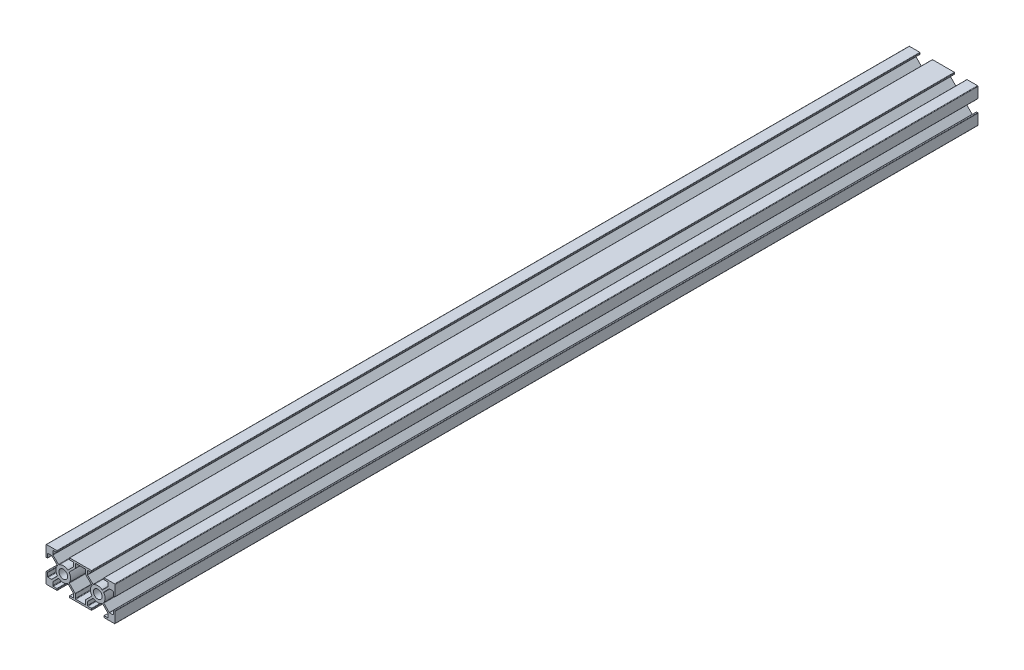
from build123d import *

# Parameters (mm, degrees)
SKETCH1_R           = 2.5
BOSS_EXTRUDE1_DEPTH = 500


with BuildPart() as part:
    # Sketch1 → Boss-Extrude1 (new body)
    with BuildSketch(Plane.XY):
        with BuildLine():
            Line((-16.626227687, 5.919120906), (-13.506610538, 2.799503757))
            ThreePointArc((-13.506610538, 2.799503757), (-13.426755903, 2.628008516), (-13.476019848, 2.445360099))
            ThreePointArc((-13.476019848, 2.445360099), (-14.25, 0), (-13.476019848, -2.445360099))
            ThreePointArc((-13.476019848, -2.445360099), (-13.426755903, -2.628008516), (-13.506610538, -2.799503757))
            Line((-13.506610538, -2.799503757), (-16.626227687, -5.919120906))
            ThreePointArc((-16.626227687, -5.919120906), (-16.715813464, -5.978980208), (-16.821487093, -6))
            Line((-16.821487093, -6), (-18.7238615, -6))
            ThreePointArc((-18.7238615, -6), (-18.919120906, -5.919120906), (-19, -5.7238615))
            Line((-19, -5.7238615), (-19, -3.7))
            ThreePointArc((-19, -3.7), (-19.058578644, -3.558578644), (-19.2, -3.5))
            Line((-19.2, -3.5), (-19.8, -3.5))
            ThreePointArc((-19.8, -3.5), (-19.941421356, -3.558578644), (-20, -3.7))
            Line((-20, -3.7), (-20, -9.7238615))
            ThreePointArc((-20, -9.7238615), (-19.919120906, -9.919120906), (-19.7238615, -10))
            Line((-19.7238615, -10), (-13.7, -10))
            ThreePointArc((-13.7, -10), (-13.558578644, -9.941421356), (-13.5, -9.8))
            Line((-13.5, -9.8), (-13.5, -9.2))
            ThreePointArc((-13.5, -9.2), (-13.558578644, -9.058578644), (-13.7, -9))
            Line((-13.7, -9), (-15.7238615, -9))
            ThreePointArc((-15.7238615, -9), (-15.919120906, -8.919120906), (-16, -8.7238615))
            Line((-16, -8.7238615), (-16, -6.821487093))
            ThreePointArc((-16, -6.821487093), (-15.978980208, -6.715813464), (-15.919120906, -6.626227687))
            Line((-15.919120906, -6.626227687), (-12.799503757, -3.506610538))
            ThreePointArc((-12.799503757, -3.506610538), (-12.628008516, -3.426755903), (-12.445360099, -3.476019848))
            ThreePointArc((-12.445360099, -3.476019848), (-10, -4.25), (-7.554639901, -3.476019848))
            ThreePointArc((-7.554639901, -3.476019848), (-7.371991484, -3.426755903), (-7.200496243, -3.506610538))
            Line((-7.200496243, -3.506610538), (-4.080879094, -6.626227687))
            ThreePointArc((-4.080879094, -6.626227687), (-4.021019792, -6.715813464), (-4, -6.821487093))
            Line((-4, -6.821487093), (-4, -8.7238615))
            ThreePointArc((-4, -8.7238615), (-4.080879094, -8.919120906), (-4.2761385, -9))
            Line((-4.2761385, -9), (-6.3, -9))
            ThreePointArc((-6.3, -9), (-6.441421356, -9.058578644), (-6.5, -9.2))
            Line((-6.5, -9.2), (-6.5, -9.8))
            ThreePointArc((-6.5, -9.8), (-6.441421356, -9.941421356), (-6.3, -10))
            Line((-6.3, -10), (6.3, -10))
            ThreePointArc((6.3, -10), (6.441421356, -9.941421356), (6.5, -9.8))
            Line((6.5, -9.8), (6.5, -9.2))
            ThreePointArc((6.5, -9.2), (6.441421356, -9.058578644), (6.3, -9))
            Line((6.3, -9), (4.2761385, -9))
            ThreePointArc((4.2761385, -9), (4.080879094, -8.919120906), (4, -8.7238615))
            Line((4, -8.7238615), (4, -6.821487093))
            ThreePointArc((4, -6.821487093), (4.021019792, -6.715813464), (4.080879094, -6.626227687))
            Line((4.080879094, -6.626227687), (7.200496243, -3.506610538))
            ThreePointArc((7.200496243, -3.506610538), (7.371991484, -3.426755903), (7.554639901, -3.476019848))
            ThreePointArc((7.554639901, -3.476019848), (10, -4.25), (12.445360099, -3.476019848))
            ThreePointArc((12.445360099, -3.476019848), (12.628008516, -3.426755903), (12.799503757, -3.506610538))
            Line((12.799503757, -3.506610538), (15.919120906, -6.626227687))
            ThreePointArc((15.919120906, -6.626227687), (15.978980208, -6.715813464), (16, -6.821487093))
            Line((16, -6.821487093), (16, -8.7238615))
            ThreePointArc((16, -8.7238615), (15.919120906, -8.919120906), (15.7238615, -9))
            Line((15.7238615, -9), (13.7, -9))
            ThreePointArc((13.7, -9), (13.558578644, -9.058578644), (13.5, -9.2))
            Line((13.5, -9.2), (13.5, -9.8))
            ThreePointArc((13.5, -9.8), (13.558578644, -9.941421356), (13.7, -10))
            Line((13.7, -10), (19.7238615, -10))
            ThreePointArc((19.7238615, -10), (19.919120906, -9.919120906), (20, -9.7238615))
            Line((20, -9.7238615), (20, -3.7))
            ThreePointArc((20, -3.7), (19.941421356, -3.558578644), (19.8, -3.5))
            Line((19.8, -3.5), (19.2, -3.5))
            ThreePointArc((19.2, -3.5), (19.058578644, -3.558578644), (19, -3.7))
            Line((19, -3.7), (19, -5.7238615))
            ThreePointArc((19, -5.7238615), (18.919120906, -5.919120906), (18.7238615, -6))
            Line((18.7238615, -6), (16.821487093, -6))
            ThreePointArc((16.821487093, -6), (16.715813464, -5.978980208), (16.626227687, -5.919120906))
            Line((16.626227687, -5.919120906), (13.506610538, -2.799503757))
            ThreePointArc((13.506610538, -2.799503757), (13.426755903, -2.628008516), (13.476019848, -2.445360099))
            ThreePointArc((13.476019848, -2.445360099), (14.25, 0), (13.476019848, 2.445360099))
            ThreePointArc((13.476019848, 2.445360099), (13.426755903, 2.628008516), (13.506610538, 2.799503757))
            Line((13.506610538, 2.799503757), (16.626227687, 5.919120906))
            ThreePointArc((16.626227687, 5.919120906), (16.715813464, 5.978980208), (16.821487093, 6))
            Line((16.821487093, 6), (18.7238615, 6))
            ThreePointArc((18.7238615, 6), (18.919120906, 5.919120906), (19, 5.7238615))
            Line((19, 5.7238615), (19, 3.7))
            ThreePointArc((19, 3.7), (19.058578644, 3.558578644), (19.2, 3.5))
            Line((19.2, 3.5), (19.8, 3.5))
            ThreePointArc((19.8, 3.5), (19.941421356, 3.558578644), (20, 3.7))
            Line((20, 3.7), (20, 9.7238615))
            ThreePointArc((20, 9.7238615), (19.919120906, 9.919120906), (19.7238615, 10))
            Line((19.7238615, 10), (13.7, 10))
            ThreePointArc((13.7, 10), (13.558578644, 9.941421356), (13.5, 9.8))
            Line((13.5, 9.8), (13.5, 9.2))
            ThreePointArc((13.5, 9.2), (13.558578644, 9.058578644), (13.7, 9))
            Line((13.7, 9), (15.7238615, 9))
            ThreePointArc((15.7238615, 9), (15.919120906, 8.919120906), (16, 8.7238615))
            Line((16, 8.7238615), (16, 6.821487093))
            ThreePointArc((16, 6.821487093), (15.978980208, 6.715813464), (15.919120906, 6.626227687))
            Line((15.919120906, 6.626227687), (12.799503757, 3.506610538))
            ThreePointArc((12.799503757, 3.506610538), (12.628008516, 3.426755903), (12.445360099, 3.476019848))
            ThreePointArc((12.445360099, 3.476019848), (10, 4.25), (7.554639901, 3.476019848))
            ThreePointArc((7.554639901, 3.476019848), (7.371991484, 3.426755903), (7.200496243, 3.506610538))
            Line((7.200496243, 3.506610538), (4.080879094, 6.626227687))
            ThreePointArc((4.080879094, 6.626227687), (4.021019792, 6.715813464), (4, 6.821487093))
            Line((4, 6.821487093), (4, 8.7238615))
            ThreePointArc((4, 8.7238615), (4.080879094, 8.919120906), (4.2761385, 9))
            Line((4.2761385, 9), (6.3, 9))
            ThreePointArc((6.3, 9), (6.441421356, 9.058578644), (6.5, 9.2))
            Line((6.5, 9.2), (6.5, 9.8))
            ThreePointArc((6.5, 9.8), (6.441421356, 9.941421356), (6.3, 10))
            Line((6.3, 10), (-6.3, 10))
            ThreePointArc((-6.3, 10), (-6.441421356, 9.941421356), (-6.5, 9.8))
            Line((-6.5, 9.8), (-6.5, 9.2))
            ThreePointArc((-6.5, 9.2), (-6.441421356, 9.058578644), (-6.3, 9))
            Line((-6.3, 9), (-4.2761385, 9))
            ThreePointArc((-4.2761385, 9), (-4.080879094, 8.919120906), (-4, 8.7238615))
            Line((-4, 8.7238615), (-4, 6.821487093))
            ThreePointArc((-4, 6.821487093), (-4.021019792, 6.715813464), (-4.080879094, 6.626227687))
            Line((-4.080879094, 6.626227687), (-7.369219294, 3.337887487))
            ThreePointArc((-7.369219294, 3.337887487), (-9.884391446, 4.248427316), (-12.445360099, 3.476019848))
            ThreePointArc((-12.445360099, 3.476019848), (-12.628008516, 3.426755903), (-12.799503757, 3.506610538))
            Line((-12.799503757, 3.506610538), (-15.919120906, 6.626227687))
            ThreePointArc((-15.919120906, 6.626227687), (-15.978980208, 6.715813464), (-16, 6.821487093))
            Line((-16, 6.821487093), (-16, 8.7238615))
            ThreePointArc((-16, 8.7238615), (-15.919120906, 8.919120906), (-15.7238615, 9))
            Line((-15.7238615, 9), (-13.7, 9))
            ThreePointArc((-13.7, 9), (-13.558578644, 9.058578644), (-13.5, 9.2))
            Line((-13.5, 9.2), (-13.5, 9.8))
            ThreePointArc((-13.5, 9.8), (-13.558578644, 9.941421356), (-13.7, 10))
            Line((-13.7, 10), (-19.7238615, 10))
            ThreePointArc((-19.7238615, 10), (-19.919120906, 9.919120906), (-20, 9.7238615))
            Line((-20, 9.7238615), (-20, 3.7))
            ThreePointArc((-20, 3.7), (-19.941421356, 3.558578644), (-19.8, 3.5))
            Line((-19.8, 3.5), (-19.2, 3.5))
            ThreePointArc((-19.2, 3.5), (-19.058578644, 3.558578644), (-19, 3.7))
            Line((-19, 3.7), (-19, 5.7238615))
            ThreePointArc((-19, 5.7238615), (-18.919120906, 5.919120906), (-18.7238615, 6))
            Line((-18.7238615, 6), (-16.821487093, 6))
            ThreePointArc((-16.821487093, 6), (-16.715813464, 5.978980208), (-16.626227687, 5.919120906))
        make_face()
        with Locations((-10, 0)):
            Circle(SKETCH1_R, mode=Mode.SUBTRACT)
        with Locations((10, 0)):
            Circle(SKETCH1_R, mode=Mode.SUBTRACT)
        with BuildLine():
            Line((3.080879094, 6.212014125), (6.493389462, 2.799503757))
            ThreePointArc((6.493389462, 2.799503757), (6.573244097, 2.628008516), (6.523980152, 2.445360099))
            ThreePointArc((6.523980152, 2.445360099), (5.75, 0), (6.523980152, -2.445360099))
            ThreePointArc((6.523980152, -2.445360099), (6.573244097, -2.628008516), (6.493389462, -2.799503757))
            Line((6.493389462, -2.799503757), (3.080879094, -6.212014125))
            ThreePointArc((3.080879094, -6.212014125), (3.021019792, -6.301599902), (3, -6.407273531))
            Line((3, -6.407273531), (3, -8.7238615))
            ThreePointArc((3, -8.7238615), (2.919120906, -8.919120906), (2.7238615, -9))
            Line((2.7238615, -9), (-2.7238615, -9))
            ThreePointArc((-2.7238615, -9), (-2.919120906, -8.919120906), (-3, -8.7238615))
            Line((-3, -8.7238615), (-3, -6.407273531))
            ThreePointArc((-3, -6.407273531), (-3.021019792, -6.301599902), (-3.080879094, -6.212014125))
            Line((-3.080879094, -6.212014125), (-6.493389462, -2.799503757))
            ThreePointArc((-6.493389462, -2.799503757), (-6.573244097, -2.628008516), (-6.523980152, -2.445360099))
            ThreePointArc((-6.523980152, -2.445360099), (-5.751572684, 0.115608554), (-6.662112513, 2.630780706))
            Line((-6.662112513, 2.630780706), (-3.080879094, 6.212014125))
            ThreePointArc((-3.080879094, 6.212014125), (-3.021019792, 6.301599902), (-3, 6.407273531))
            Line((-3, 6.407273531), (-3, 8.7238615))
            ThreePointArc((-3, 8.7238615), (-2.919120906, 8.919120906), (-2.7238615, 9))
            Line((-2.7238615, 9), (2.7238615, 9))
            ThreePointArc((2.7238615, 9), (2.919120906, 8.919120906), (3, 8.7238615))
            Line((3, 8.7238615), (3, 6.407273531))
            ThreePointArc((3, 6.407273531), (3.021019792, 6.301599902), (3.080879094, 6.212014125))
        make_face(mode=Mode.SUBTRACT)
    extrude(amount=BOSS_EXTRUDE1_DEPTH)


solid = part.part
